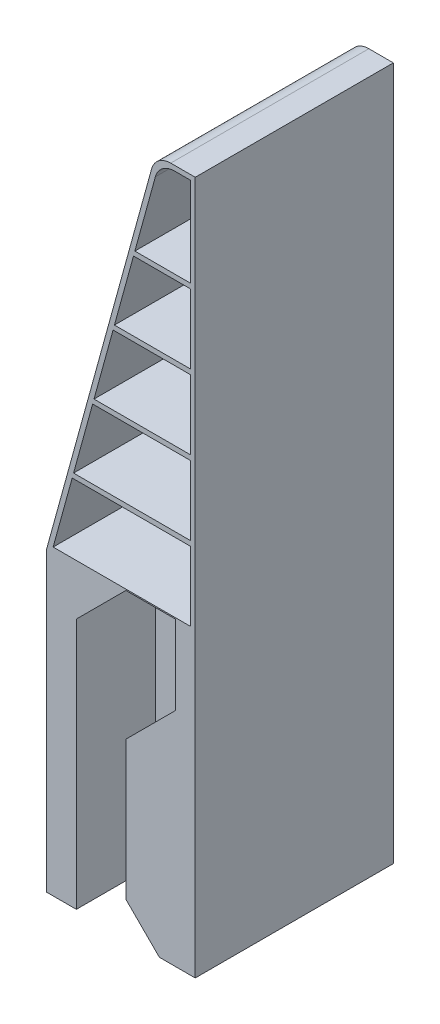
from build123d import *

# Parameters (mm, degrees)
BOSS_EXTRUDE1_DEPTH      = 10
BOSS_EXTRUDE1_DEPTH_BACK = 10
CUT_EXTRUDE1_DEPTH       = 8
CUT_EXTRUDE2_DEPTH       = 57.402570863
CUT_EXTRUDE2_DEPTH_BACK  = 57.402570863
SKETCH4_R                = 1.75


with BuildPart() as part:
    # Sketch1 → Boss-Extrude1 (new, two sides: drawn at the far end of the back side and taken through both)
    with BuildSketch(Plane.XY.offset(-BOSS_EXTRUDE1_DEPTH_BACK)):
        with BuildLine():
            Line((7.5, -15), (7.5, 15))
            Line((7.5, 15), (7.5, 55))
            Line((7.5, 55), (5.024246851, 55))
            ThreePointArc((5.024246851, 55), (3.811940358, 54.590695749), (3.095836066, 53.530312966))
            Line((3.095836066, 53.530312966), (-7.5, 15))
            Line((-7.5, 15), (-7.5, -15))
            Line((-7.5, -15), (7.5, -15))
        make_face()
        Polygon((7, 15.5), (-6.843938287, 15.5), (-4.918938287, 22.5), (7, 22.5), align=None, mode=Mode.SUBTRACT)
        Polygon((7, 30), (7, 23), (-4.781438287, 23), (-2.856438287, 30), align=None, mode=Mode.SUBTRACT)
        Polygon((7, 37.5), (7, 30.5), (-2.718938287, 30.5), (-0.793938287, 37.5), align=None, mode=Mode.SUBTRACT)
        Polygon((7, 38), (-0.656438287, 38), (1.268561713, 45), (7, 45), align=None, mode=Mode.SUBTRACT)
        with BuildLine():
            ThreePointArc((3.476897778, 53.030312966), (4.193002071, 54.090695749), (5.405308564, 54.5))
            Line((5.405308564, 54.5), (7, 54.5))
            Line((7, 54.5), (7, 45.5))
            Line((7, 45.5), (1.406061713, 45.5))
            Line((1.406061713, 45.5), (3.476897778, 53.030312966))
        make_face(mode=Mode.SUBTRACT)
    extrude(amount=BOSS_EXTRUDE1_DEPTH + BOSS_EXTRUDE1_DEPTH_BACK)

    # Sketch2 → Cut-Extrude1 (cut)
    with BuildSketch(Plane.XY.offset(10)):
        Polygon((5.5, 7.378745231), (5.5, 15.378745231), (0.5, 15.378745231), (-4.5, 10.378745231), (-4.5, -15.621254769), (4.5, -15.621254769), (0.5, -11.621254769), (0.5, 2.378745231), align=None)
    cut_extrude1 = extrude(amount=-CUT_EXTRUDE1_DEPTH, mode=Mode.SUBTRACT)

    # Mirror1: Cut-Extrude1 across plane
    add(cut_extrude1.mirror(Plane.XY), mode=Mode.SUBTRACT)

    # Sketch4 → Cut-Extrude2 (cut, two sides: drawn at the far end of the back side and taken through both)
    with BuildSketch(Plane.XY.offset(-CUT_EXTRUDE2_DEPTH_BACK)):
        with Locations((1.5, 9.378745231)):
            Circle(SKETCH4_R)
    extrude(amount=CUT_EXTRUDE2_DEPTH + CUT_EXTRUDE2_DEPTH_BACK, mode=Mode.SUBTRACT)


solid = part.part
